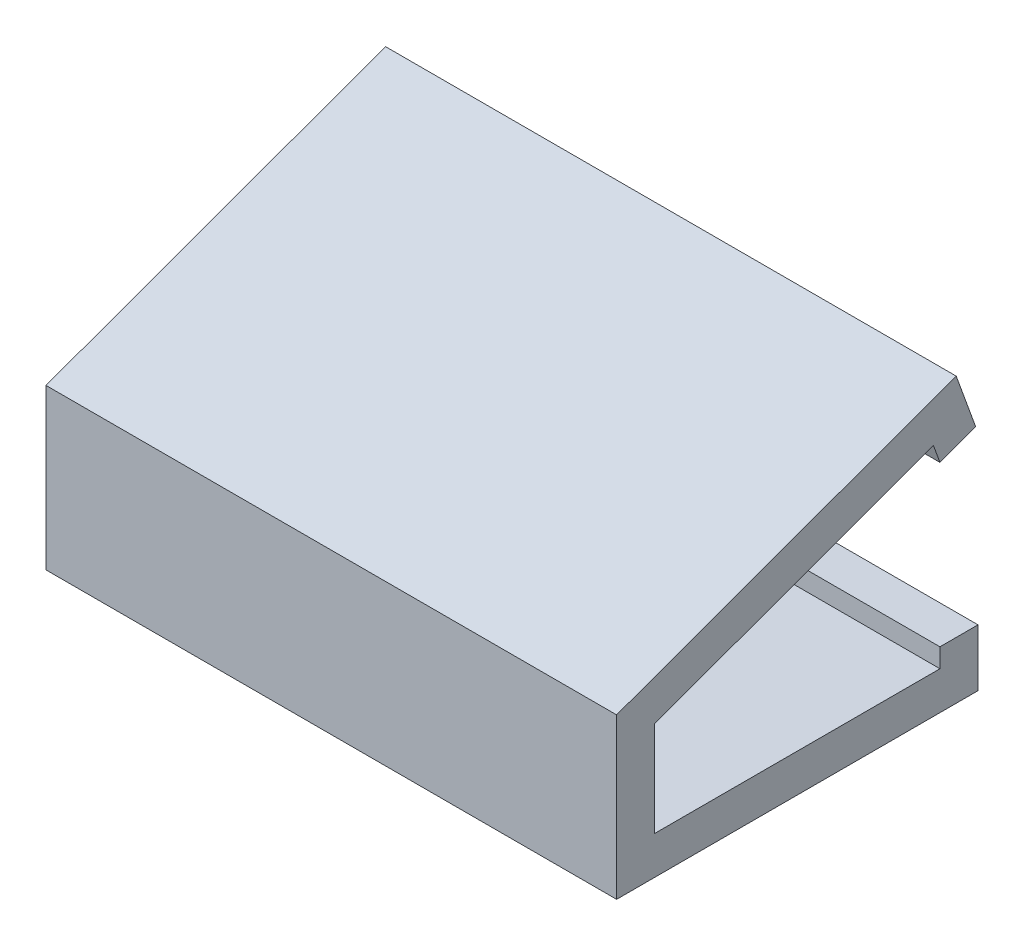
from build123d import *

# Parameters (mm, degrees)
MAINBODY_DEPTH = 150


with BuildPart() as part:
    # Sketch2 → MainBody (new body)
    with BuildSketch(Plane(origin=(0, 0, 0), x_dir=(0, 0, -1), z_dir=(1, 0, 0))):
        Polygon((53.907362295, -0.400839959), (53.907362295, -15.400839959), (-41.092637705, -15.400839959), (-41.092637705, 26.601235423), (48.173986353, 59.091629493), (53.304288503, 44.996240182), (43.907362295, 41.576038748), (42.197261579, 46.274501852), (-31.092637705, 19.599160041), (-31.092637705, -5.400839959), (43.907362295, -5.400839959), (43.907362295, -0.400839959), align=None)
    extrude(amount=MAINBODY_DEPTH)


solid = part.part
